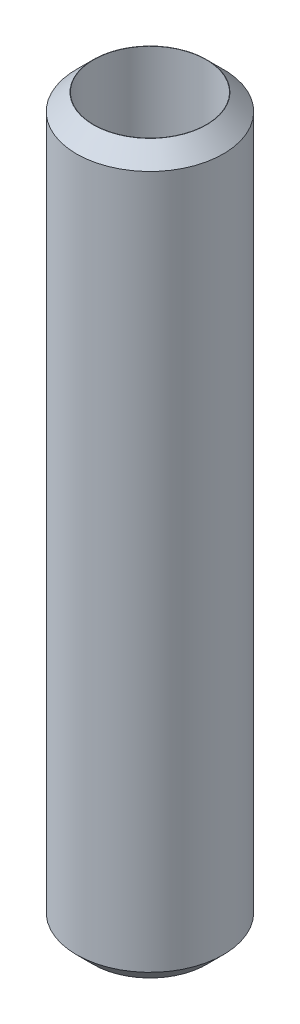
from build123d import *

# Parameters (mm, degrees)
SKETCH1_R           = 17.5
BOSS_EXTRUDE1_DEPTH = 173.412976698
SKETCH2_R           = 13.429846918
CUT_EXTRUDE1_DEPTH  = 176.170090161
CHAMFER1_SIZE       = 4.007287011


with BuildPart() as part:
    # Sketch1 → Boss-Extrude1 (new body)
    with BuildSketch(Plane(origin=(0, 0, 0), x_dir=(1, 0, 0), z_dir=(0, 1, 0))):
        Circle(SKETCH1_R)
    extrude(amount=BOSS_EXTRUDE1_DEPTH)

    # Sketch2 → Cut-Extrude1 (cut, through all)
    with BuildSketch(Plane(origin=(0, 0, 0), x_dir=(1, 0, 0), z_dir=(0, 1, 0))):
        Circle(SKETCH2_R)
    extrude(amount=CUT_EXTRUDE1_DEPTH, mode=Mode.SUBTRACT)

    # Chamfer1
    chamfer1_edges = [part.edges().sort_by_distance(p)[0] for p in [
        (-17.5, 173.412976698, 0),
        (-17.5, 0, 0),
    ]]
    chamfer(chamfer1_edges, length=CHAMFER1_SIZE)


solid = part.part
